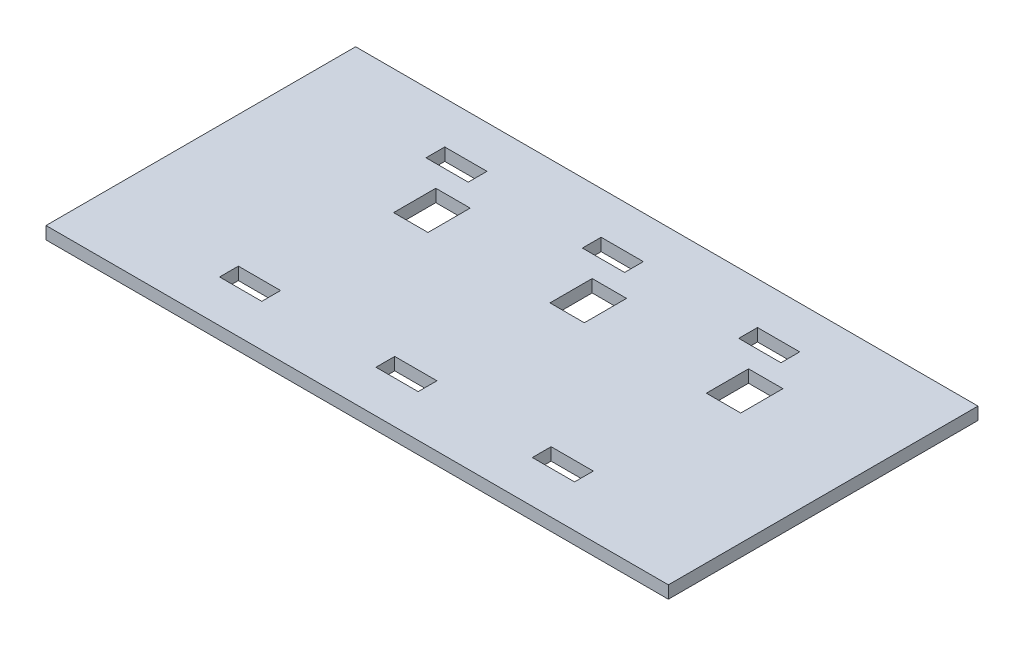
from build123d import *

# Parameters (mm, degrees)
SKETCH1_W                 = 101.092
SKETCH1_H                 = 50.292
BOSS_EXTRUDE1_DEPTH       = 2.032
SKETCH2_W                 = 5.588
SKETCH2_H                 = 6.858
WIRE_HOLE_DEPTH           = 57.492021171
SKETCH3_W                 = 6.858
SKETCH3_H                 = 3.048
CUT_EXTRUDE2_DEPTH        = 57.492021171
LPATTERN1_COUNT           = 2
LPATTERN1_PITCH           = 25.4
LPATTERN1_COUNT_DIR2      = 2
LPATTERN1_PITCH_DIR2      = 25.4
LPATTERN1_COPY_1_SKETCH_W = 6.858
LPATTERN1_COPY_1_SKETCH_H = 3.048
LPATTERN1_COPY_1_DEPTH    = 57.492021171
LPATTERN1_COPY_2_SKETCH_W = 6.858
LPATTERN1_COPY_2_SKETCH_H = 3.048
LPATTERN1_COPY_2_DEPTH    = 57.492021171
LPATTERN1_COPY_3_SKETCH_W = 6.858
LPATTERN1_COPY_3_SKETCH_H = 3.048
LPATTERN1_COPY_3_DEPTH    = 57.492021171


with BuildPart() as part:
    # Sketch1 → Boss-Extrude1 (new body)
    with BuildSketch(Plane(origin=(0, 0, 0), x_dir=(1, 0, 0), z_dir=(0, 1, 0))):
        Rectangle(SKETCH1_W, SKETCH1_H)
    extrude(amount=BOSS_EXTRUDE1_DEPTH)

    # Sketch2 → Wire Hole (cut, through all)
    with BuildSketch(Plane(origin=(0, 2.032, 0), x_dir=(1, 0, 0), z_dir=(0, 1, 0))):
        with Locations((4.064, 8.322545685)):
            Rectangle(SKETCH2_W, SKETCH2_H)
    wire_hole = extrude(amount=-WIRE_HOLE_DEPTH, mode=Mode.SUBTRACT)

    # Sketch3 → Cut-Extrude2 (cut, through all)
    with BuildSketch(Plane(origin=(0, 2.032, 0), x_dir=(1, 0, 0), z_dir=(0, 1, 0))):
        with Locations((-0.381, 16.764)):
            Rectangle(SKETCH3_W, SKETCH3_H)
    cut_extrude2 = extrude(amount=-CUT_EXTRUDE2_DEPTH, mode=Mode.SUBTRACT)

    # Mirror1: Cut-Extrude2 across plane
    add(cut_extrude2.mirror(Plane.XY), mode=Mode.SUBTRACT)

    # LPattern1: Wire Hole, Cut-Extrude2 2 × 2
    with Locations(*[Vector(-1, 0, 0) * (i * LPATTERN1_PITCH) + Vector(1, 0, 0) * (j * LPATTERN1_PITCH_DIR2) for i in range(LPATTERN1_COUNT) for j in range(LPATTERN1_COUNT_DIR2) if (i, j) != (0, 0)]):
        add(wire_hole, mode=Mode.SUBTRACT)
        add(cut_extrude2, mode=Mode.SUBTRACT)

    # LPattern1 copy 1 sketch → LPattern1 copy 1 (cut, through all)
    with BuildSketch(Plane(origin=(25.4, 2.032, 0), x_dir=(1, 0, 0), z_dir=(0, 1, 0))):
        with Locations((-0.381, -16.764)):
            Rectangle(LPATTERN1_COPY_1_SKETCH_W, LPATTERN1_COPY_1_SKETCH_H)
    extrude(amount=-LPATTERN1_COPY_1_DEPTH, mode=Mode.SUBTRACT)

    # LPattern1 copy 2 sketch → LPattern1 copy 2 (cut, through all)
    with BuildSketch(Plane(origin=(-25.4, 2.032, 0), x_dir=(1, 0, 0), z_dir=(0, 1, 0))):
        with Locations((-0.381, -16.764)):
            Rectangle(LPATTERN1_COPY_2_SKETCH_W, LPATTERN1_COPY_2_SKETCH_H)
    extrude(amount=-LPATTERN1_COPY_2_DEPTH, mode=Mode.SUBTRACT)

    # LPattern1 copy 3 sketch → LPattern1 copy 3 (cut, through all)
    with BuildSketch(Plane(origin=(0, 2.032, 0), x_dir=(1, 0, 0), z_dir=(0, 1, 0))):
        with Locations((-0.381, -16.764)):
            Rectangle(LPATTERN1_COPY_3_SKETCH_W, LPATTERN1_COPY_3_SKETCH_H)
    extrude(amount=-LPATTERN1_COPY_3_DEPTH, mode=Mode.SUBTRACT)


solid = part.part
